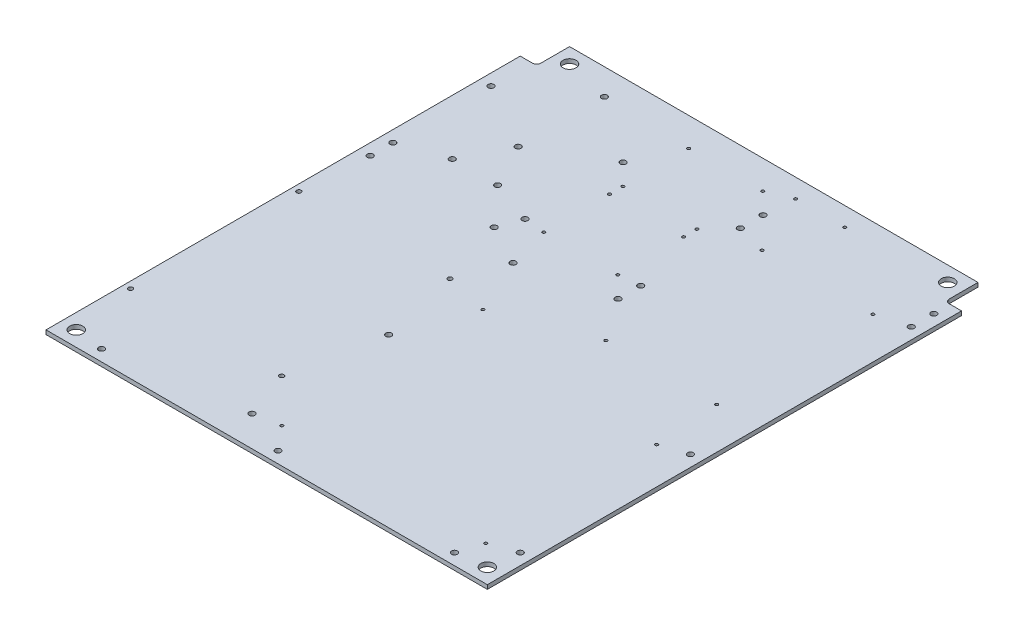
from build123d import *

# Parameters (mm, degrees)
SKETCH1_W               = 340.868
SKETCH1_H               = 391.668
BOSS_EXTRUDE1_DEPTH     = 3.175
CUT_EXTRUDE1_DEPTH      = 10
F_3_8_CLEARANCE_HOLE1_D = 10.0838
F_4_40_TAPPED_HOLE1_D   = 2.2606
F_8_32_TAPPED_HOLE1_D   = 3.4544
F_4_40_TAPPED_HOLE2_D   = 2.2606
F_4_40_TAPPED_HOLE3_D   = 2.2606
F_8_CLEARANCE_HOLE1_D   = 4.4958


with BuildPart() as part:
    # Sketch1 → Boss-Extrude1 (new body)
    with BuildSketch(Plane(origin=(0, 0, 0), x_dir=(1, 0, 0), z_dir=(0, 1, 0))):
        Rectangle(SKETCH1_W, SKETCH1_H)
    extrude(amount=BOSS_EXTRUDE1_DEPTH)

    # Sketch2 → Cut-Extrude1 (cut)
    with BuildSketch(Plane(origin=(0, 3.175, 0), x_dir=(1, 0, 0), z_dir=(0, 1, 0))):
        with BuildLine():
            Line((-170.434, 195.834), (-157.734, 195.834))
            Line((-157.734, 195.834), (-157.734, 173.609))
            ThreePointArc((-157.734, 173.609), (-158.66393597, 171.36393597), (-160.909, 170.434))
            Line((-160.909, 170.434), (-170.434, 170.434))
            Line((-170.434, 170.434), (-170.434, 195.834))
        make_face()
        with BuildLine():
            Line((170.434, 195.834), (157.734, 195.834))
            Line((157.734, 195.834), (157.734, 173.609))
            ThreePointArc((157.734, 173.609), (158.66393597, 171.36393597), (160.909, 170.434))
            Line((160.909, 170.434), (170.434, 170.434))
            Line((170.434, 170.434), (170.434, 195.834))
        make_face()
    extrude(amount=-CUT_EXTRUDE1_DEPTH, mode=Mode.SUBTRACT)

    # 3/8 Clearance Hole1 (through all)
    with Locations(Plane(origin=(0, 3.175, 0), x_dir=(1, 0, 0), z_dir=(0, 1, 0))):
        with Locations((158.75, -184.15), (-158.75, -184.15), (-146.05, 184.15), (146.05, 184.15)):
            Hole(F_3_8_CLEARANCE_HOLE1_D / 2)

    # #4-40 Tapped Hole1 (through all)
    with Locations(Plane(origin=(0, 3.175, 0), x_dir=(1, 0, 0), z_dir=(0, 1, 0))):
        with Locations((-15.34, -13.51), (142.14, -36.73), (142.14, -168.81), (-15.34, -168.81), (-43.575, 61.759), (13.575, 61.759), (13.575, 112.559), (-43.575, 112.559), (-43.575, 122.909), (-43.575, 173.709), (13.575, 173.709), (13.575, 122.909)):
            Hole(F_4_40_TAPPED_HOLE1_D / 2)

    # #8-32 Tapped Hole1 (through all)
    with Locations(Plane(origin=(0, 3.175, 0), x_dir=(1, 0, 0), z_dir=(0, 1, 0))):
        with Locations((-165.334, -5.625), (-165.334, -135.625), (-48.634, -135.625), (-48.634, -5.625)):
            Hole(F_8_32_TAPPED_HOLE1_D / 2)

    # #4-40 Tapped Hole2 (through all)
    with Locations(Plane(origin=(0, 3.175, 0), x_dir=(1, 0, 0), z_dir=(0, 1, 0))):
        with Locations((138.509, 13.259), (52.859, 13.259), (138.509, 133.909), (52.859, 133.909)):
            Hole(F_4_40_TAPPED_HOLE2_D / 2)

    # #4-40 Tapped Hole3 (through all)
    with Locations(Plane(origin=(0, 3.175, 0), x_dir=(1, 0, 0), z_dir=(0, 1, 0))):
        with Locations((69.434, 181.209), (31.434, 181.209)):
            Hole(F_4_40_TAPPED_HOLE3_D / 2)

    # #8 Clearance Hole1 (through all)
    with Locations(Plane(origin=(0, 3.175, 0), x_dir=(1, 0, 0), z_dir=(0, 1, 0))):
        with Locations((-127.822204925, 75.308262345), (-92.822204925, 75.308262345), (-59.684, 139.084), (-59.684, 63.334), (-161.684, 45.834), (-161.684, 63.334), (-161.684, 139.084), (29.684, 45.834), (29.684, 63.334), (29.684, 140.334), (29.684, 157.834), (161.684, 157.834), (161.684, 140.334), (161.684, -161.684), (161.684, -30.234842243), (136.284, -187.084), (0, -187.084), (-136.284, -187.084), (-34.884, -172.317967199), (-34.884, 29.326829284), (-34.884, -66.774616542), (-66, 45.834), (-110.684, 175.684), (-110.684, 109.084)):
            Hole(F_8_CLEARANCE_HOLE1_D / 2)


solid = part.part
